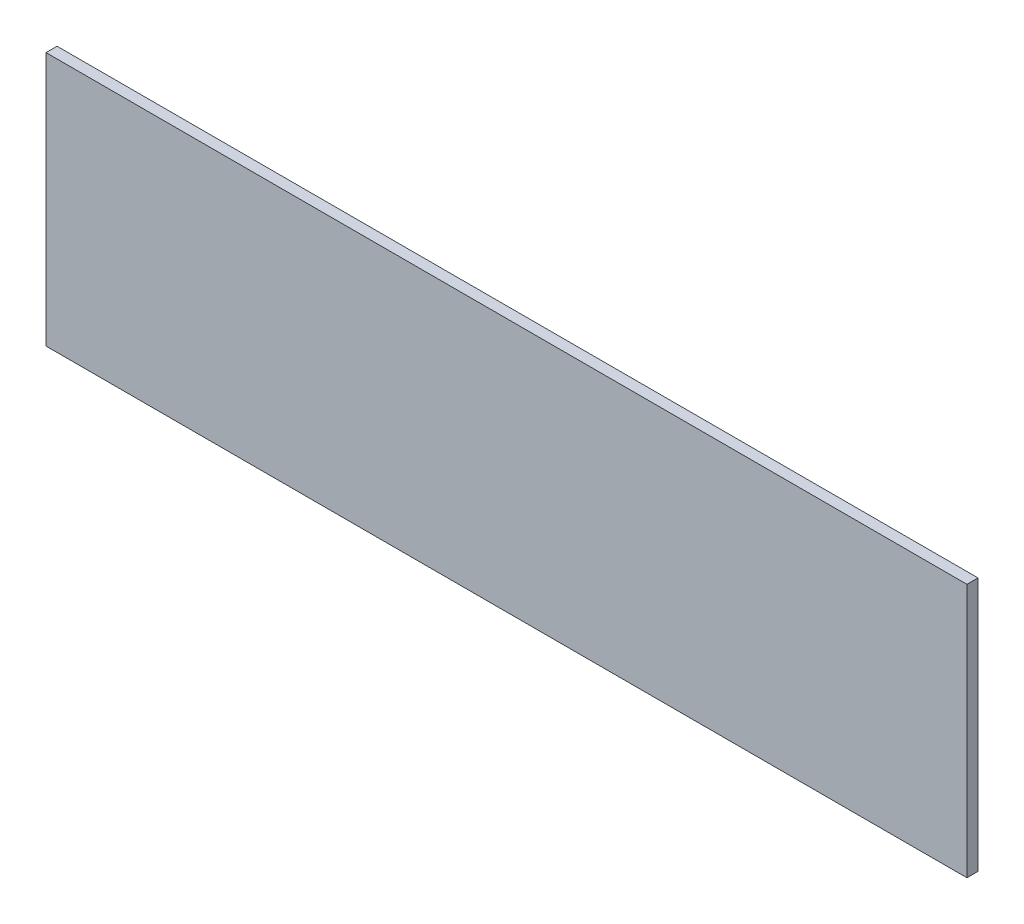
from build123d import *

# Parameters (mm, degrees)
SKETCH1_W           = 1000
SKETCH1_H           = 276
BOSS_EXTRUDE1_DEPTH = 12


with BuildPart() as part:
    # Sketch1 → Boss-Extrude1 (new body)
    with BuildSketch(Plane.XY):
        with Locations((500, 138)):
            Rectangle(SKETCH1_W, SKETCH1_H)
    extrude(amount=BOSS_EXTRUDE1_DEPTH)


solid = part.part
